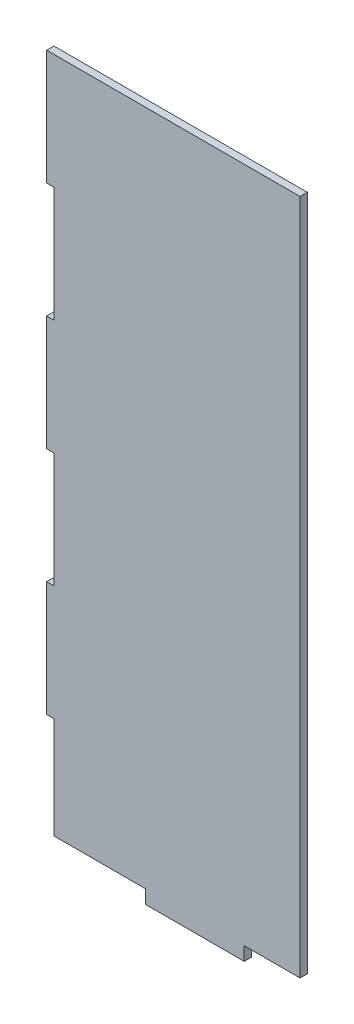
from build123d import *

# Parameters (mm, degrees)
BOSS_EXTRUDE1_DEPTH = 1.4986
MIRROR1_START       = -139.7
MIRROR1_OUTLINE_W   = 101.6
MIRROR1_OUTLINE_H   = 2.9972
MIRROR1_DEPTH       = 279.4
MIRROR1_START_2     = -145.288
MIRROR1_2_OUTLINE_W = 40.770628572
MIRROR1_2_OUTLINE_H = 2.9972
MIRROR1_2_DEPTH     = 5.588
MIRROR1_START_3     = -97.79
MIRROR1_3_OUTLINE_W = 2.9972
MIRROR1_3_OUTLINE_H = 2.9972
MIRROR1_3_DEPTH     = 47.498
MIRROR1_START_4     = -2.794
MIRROR1_4_OUTLINE_W = 2.9972
MIRROR1_4_OUTLINE_H = 2.9972
MIRROR1_4_DEPTH     = 47.498
MIRROR1_START_5     = 92.202
MIRROR1_5_OUTLINE_W = 2.9972
MIRROR1_5_OUTLINE_H = 2.9972
MIRROR1_5_DEPTH     = 47.498
CUT_EXTRUDE2_DEPTH  = 204.666583022


# Read off the part's stored shape, not the designer's step: Mirror1
with BuildPart() as part:
    # Sketch1 → Boss-Extrude1 (new, symmetric)
    with BuildSketch(Plane.XY):
        Polygon((-38.1, 139.7), (-142.6972, 139.7), (-142.6972, 92.202), (-139.7, 92.202), (-139.7, 44.704), (-142.6972, 44.704), (-142.6972, -2.794), (-139.7, -2.794), (-139.7, -50.292), (-142.6972, -50.292), (-142.6972, -97.79), (-139.7, -97.79), (-139.7, -139.7), (-101.926571429, -139.7), (-101.926571429, -145.288), (-61.155942857, -145.288), (-61.155942857, -139.7), (-38.1, -139.7), align=None)
    extrude(amount=BOSS_EXTRUDE1_DEPTH, both=True)

    # Mirror1 outline → Mirror1 (add)
    with BuildSketch(Plane(origin=(0, 0, 0), x_dir=(1, 0, 0), z_dir=(0, 1, 0)).offset(MIRROR1_START)):
        with Locations((12.7, 0)):
            Rectangle(MIRROR1_OUTLINE_W, MIRROR1_OUTLINE_H)
    extrude(amount=MIRROR1_DEPTH)

    # Mirror1 2 outline → Mirror1 2 (add)
    with BuildSketch(Plane(origin=(0, 0, 0), x_dir=(1, 0, 0), z_dir=(0, 1, 0)).offset(MIRROR1_START_2)):
        with Locations((5.341257143, 0)):
            Rectangle(MIRROR1_2_OUTLINE_W, MIRROR1_2_OUTLINE_H)
    extrude(amount=MIRROR1_2_DEPTH)

    # Mirror1 3 outline → Mirror1 3 (add)
    with BuildSketch(Plane(origin=(0, 0, 0), x_dir=(1, 0, 0), z_dir=(0, 1, 0)).offset(MIRROR1_START_3)):
        with Locations((64.9986, 0)):
            Rectangle(MIRROR1_3_OUTLINE_W, MIRROR1_3_OUTLINE_H)
    extrude(amount=MIRROR1_3_DEPTH)

    # Mirror1 4 outline → Mirror1 4 (add)
    with BuildSketch(Plane(origin=(0, 0, 0), x_dir=(1, 0, 0), z_dir=(0, 1, 0)).offset(MIRROR1_START_4)):
        with Locations((64.9986, 0)):
            Rectangle(MIRROR1_4_OUTLINE_W, MIRROR1_4_OUTLINE_H)
    extrude(amount=MIRROR1_4_DEPTH)

    # Mirror1 5 outline → Mirror1 5 (add)
    with BuildSketch(Plane(origin=(0, 0, 0), x_dir=(1, 0, 0), z_dir=(0, 1, 0)).offset(MIRROR1_START_5)):
        with Locations((64.9986, 0)):
            Rectangle(MIRROR1_5_OUTLINE_W, MIRROR1_5_OUTLINE_H)
    extrude(amount=MIRROR1_5_DEPTH)

    # Sketch2<3> → Cut-Extrude2 (cut, through all)
    with BuildSketch(Plane.XY.offset(1.4986)):
        Polygon((66.4972, 139.7), (-38.1, 139.7), (-38.1, -139.7), (-15.044057143, -139.7), (-15.044057143, -145.288), (25.726571429, -145.288), (25.726571429, -139.7), (63.5, -139.7), (63.5, -97.79), (66.4972, -97.79), (66.4972, -50.292), (63.5, -50.292), (63.5, -2.794), (66.4972, -2.794), (66.4972, 44.704), (63.5, 44.704), (63.5, 92.202), (66.4972, 92.202), align=None)
    extrude(amount=-CUT_EXTRUDE2_DEPTH, mode=Mode.SUBTRACT)


solid = part.part
